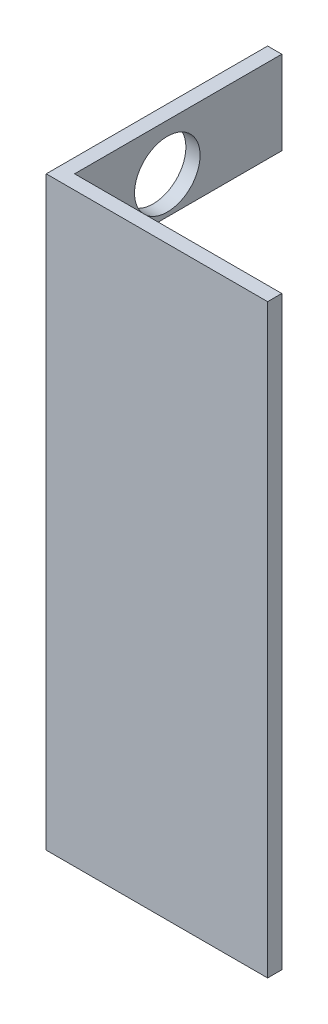
from build123d import *

# Parameters (mm, degrees)
BOSS_EXTRUDE1_DEPTH = 42
SKETCH4_W           = 14.859
SKETCH4_H           = 30
CUT_EXTRUDE2_DEPTH  = 6.35
SKETCH6_R           = 2.35
CUT_EXTRUDE3_DEPTH  = 6.35


with BuildPart() as part:
    # Sketch1 → Boss-Extrude1 (new body)
    with BuildSketch(Plane(origin=(0, 0, 0), x_dir=(1, 0, 0), z_dir=(0, 1, 0))):
        Polygon((0, 0), (15.875, 0), (15.875, 1.016), (1.016, 1.016), (1.016, 15.875), (0, 15.875), align=None)
    extrude(amount=BOSS_EXTRUDE1_DEPTH)

    # Sketch4 → Cut-Extrude2 (cut)
    with BuildSketch(Plane(origin=(1.016, 0, 0), x_dir=(0, 0, -1), z_dir=(1, 0, 0))):
        with Locations((8.4455, 21)):
            Rectangle(SKETCH4_W, SKETCH4_H)
    extrude(amount=-CUT_EXTRUDE2_DEPTH, mode=Mode.SUBTRACT)

    # Sketch6 → Cut-Extrude3 (cut)
    with BuildSketch(Plane(origin=(1.016, 0, 0), x_dir=(0, 0, -1), z_dir=(1, 0, 0))):
        with Locations((7.666, 38.65)):
            Circle(SKETCH6_R)
        with Locations((7.666, 3.35)):
            Circle(SKETCH6_R)
    extrude(amount=-CUT_EXTRUDE3_DEPTH, mode=Mode.SUBTRACT)


solid = part.part
